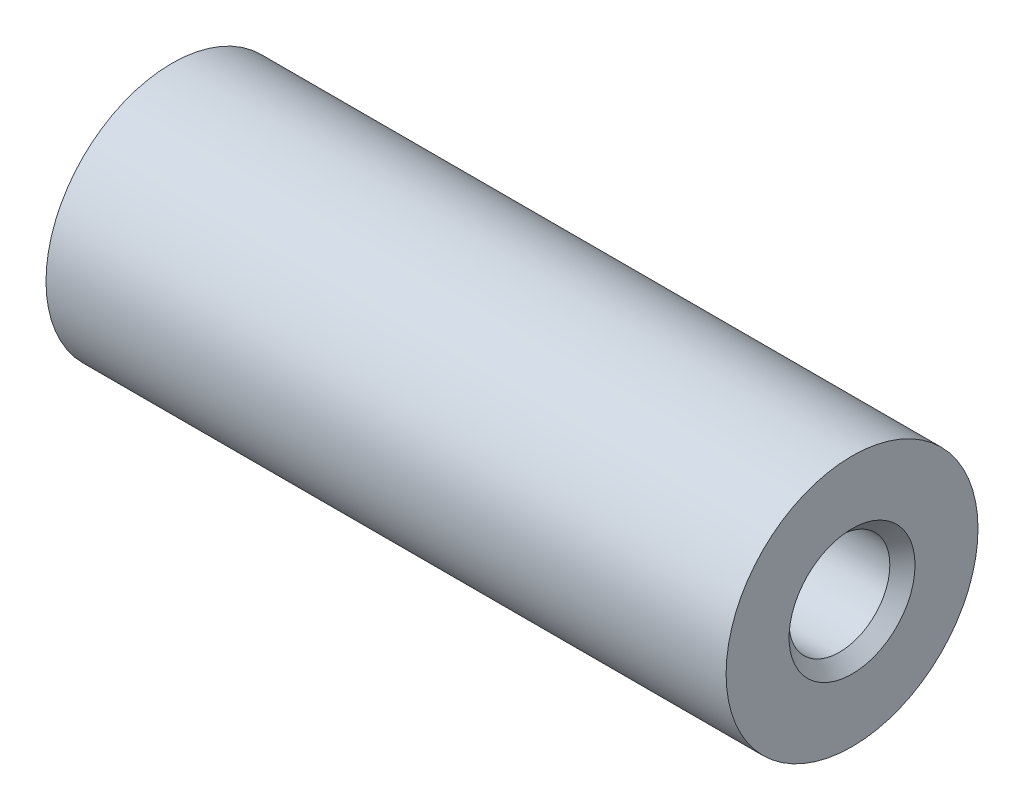
from build123d import *

# Parameters (mm, degrees)
SKIZZE1_R                        = 4
AUFSATZ_LINEAR_AUSTRAGEN1_DEPTH  = 21.6
F_3_2_3_2_DURCHMESSER_BOHRUNG1_D = 3.2
FASE1_SIZE                       = 0.4


with BuildPart() as part:
    # Skizze1 → Aufsatz-Linear austragen1 (new body)
    with BuildSketch(Plane(origin=(0, 0, 0), x_dir=(0, 0, -1), z_dir=(1, 0, 0))):
        Circle(SKIZZE1_R)
    extrude(amount=AUFSATZ_LINEAR_AUSTRAGEN1_DEPTH)

    # Ø3.2 (3.2) Durchmesser Bohrung1 (through all)
    with Locations(Plane(origin=(21.6, 0, 0), x_dir=(0, 0, -1), z_dir=(1, 0, 0))):
        with Locations((0, 0)):
            Hole(F_3_2_3_2_DURCHMESSER_BOHRUNG1_D / 2)

    # Fase1
    fase1_edges = [part.edges().sort_by_distance(p)[0] for p in [
        (21.6, 0, -1.6),
        (0, 0, -1.6),
    ]]
    chamfer(fase1_edges, length=FASE1_SIZE)


solid = part.part
